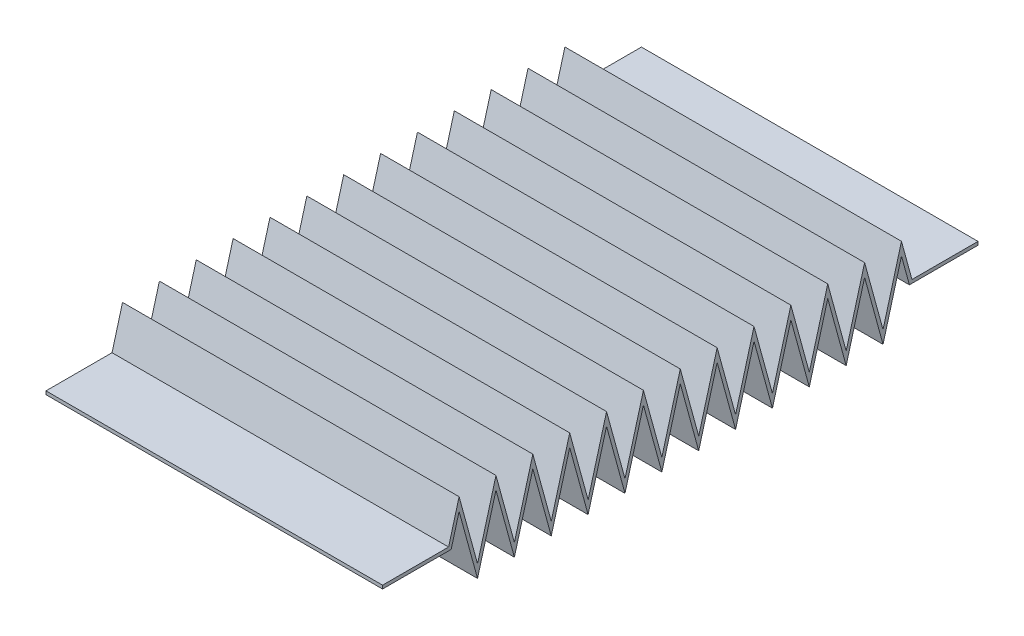
from build123d import *

# Parameters (mm, degrees)
EXTRUDE_THIN1_DEPTH = 25


with BuildPart() as part:
    # Sketch3 → Extrude-Thin1 (new, symmetric)
    with BuildSketch(Plane(origin=(0, 0, 0), x_dir=(0, 0, -1), z_dir=(1, 0, 0))):
        Polygon((0, 4.75), (10.190746188, 4.75), (11.369143568, 9.053410568), (14.107430705, -0.946589432), (16.845717841, 9.053410568), (19.584004978, -0.946589432), (22.322292114, 9.053410568), (25.06057925, -0.946589432), (27.798866387, 9.053410568), (30.537153523, -0.946589432), (33.27544066, 9.053410568), (36.013727796, -0.946589432), (38.752014933, 9.053410568), (41.490302069, -0.946589432), (44.228589206, 9.053410568), (46.966876342, -0.946589432), (49.705163479, 9.053410568), (52.443450615, -0.946589432), (55.181737751, 9.053410568), (57.920024888, -0.946589432), (60.658312024, 9.053410568), (63.396599161, -0.946589432), (66.134886297, 9.053410568), (68.873173434, -0.946589432), (71.61146057, 9.053410568), (74.349747707, -0.946589432), (77.088034843, 9.053410568), (78.266432223, 4.75), (88.457178411, 4.75), (88.457178411, 5.25), (78.6479246, 5.25), (77.088034843, 10.946589432), (74.349747707, 0.946589432), (71.61146057, 10.946589432), (68.873173434, 0.946589432), (66.134886297, 10.946589432), (63.396599161, 0.946589432), (60.658312024, 10.946589432), (57.920024888, 0.946589432), (55.181737751, 10.946589432), (52.443450615, 0.946589432), (49.705163479, 10.946589432), (46.966876342, 0.946589432), (44.228589206, 10.946589432), (41.490302069, 0.946589432), (38.752014933, 10.946589432), (36.013727796, 0.946589432), (33.27544066, 10.946589432), (30.537153523, 0.946589432), (27.798866387, 10.946589432), (25.06057925, 0.946589432), (22.322292114, 10.946589432), (19.584004978, 0.946589432), (16.845717841, 10.946589432), (14.107430705, 0.946589432), (11.369143568, 10.946589432), (9.809253812, 5.25), (0, 5.25), align=None)
    extrude(amount=EXTRUDE_THIN1_DEPTH, both=True)


solid = part.part
